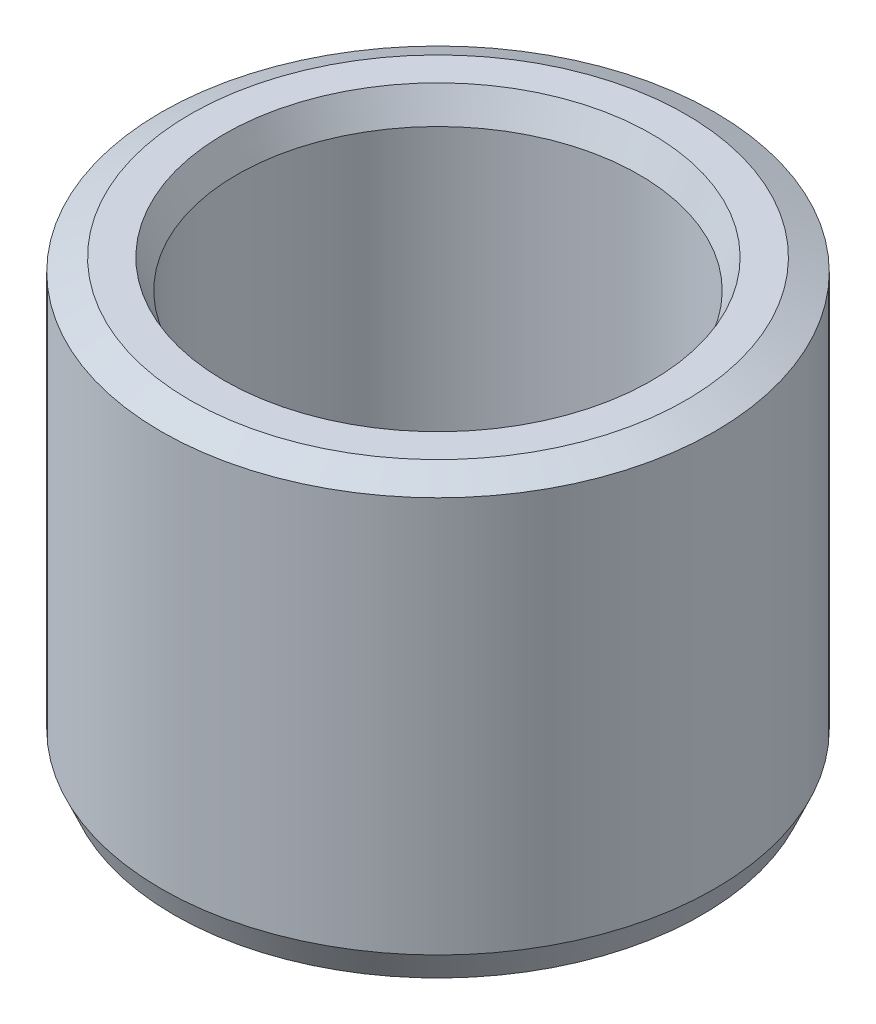
from build123d import *
from OCP.BRepFilletAPI import BRepFilletAPI_MakeChamfer

# Parameters (mm, degrees)
SKETCH1_R           = 57.5
BOSS_EXTRUDE1_DEPTH = 90.925690397
SKETCH2_R           = 41.771925017
CUT_EXTRUDE1_DEPTH  = 122.98352829
CHAMFER1_SIZE       = 2.631994766
CHAMFER1_SIZE2      = 5.999081404


with BuildPart() as part:
    # Sketch1 → Boss-Extrude1 (new body)
    with BuildSketch(Plane(origin=(0, 0, 0), x_dir=(1, 0, 0), z_dir=(0, 1, 0))):
        Circle(SKETCH1_R)
    extrude(amount=BOSS_EXTRUDE1_DEPTH)

    # Sketch2 → Cut-Extrude1 (cut, through all)
    with BuildSketch(Plane(origin=(0, 0, 0), x_dir=(1, 0, 0), z_dir=(0, 1, 0))):
        Circle(SKETCH2_R)
    extrude(amount=CUT_EXTRUDE1_DEPTH, mode=Mode.SUBTRACT)

    # Chamfer1: one chamfer whose edges measure the first distance from different faces: ONE call of the kernel's chamfer builder (chamfer() names one face for all edges)
    chamfer1_edges_1 = [part.edges().sort_by_distance(p)[0] for p in [
        (-41.771925017, 90.925690397, 0),
    ]]
    chamfer1_side_1 = [part.faces().sort_by_distance(p)[0] for p in [
        (-55.873654403, 90.925690397, 0),
    ]]
    chamfer1_edges_2 = [part.edges().sort_by_distance(p)[0] for p in [
        (-41.771925017, 0, 0),
    ]]
    chamfer1_side_2 = [part.faces().sort_by_distance(p)[0] for p in [
        (-41.771925017, 45.462845199, 0),
    ]]
    chamfer1_edges_3 = [part.edges().sort_by_distance(p)[0] for p in [
        (-57.5, 0, 0),
    ]]
    chamfer1_side_3 = [part.faces().sort_by_distance(p)[0] for p in [
        (-55.873654403, 0, 0),
    ]]
    chamfer1_edges_4 = [part.edges().sort_by_distance(p)[0] for p in [
        (-57.5, 90.925690397, 0),
    ]]
    chamfer1_side_4 = [part.faces().sort_by_distance(p)[0] for p in [
        (-57.5, 45.462845199, 0),
    ]]
    chamfer1 = BRepFilletAPI_MakeChamfer(part.part.solid().wrapped)
    for e in chamfer1_edges_1:
        chamfer1.Add(CHAMFER1_SIZE, CHAMFER1_SIZE2, e.wrapped, chamfer1_side_1[0].wrapped)  # the first distance lies on this face
    for e in chamfer1_edges_2:
        chamfer1.Add(CHAMFER1_SIZE, CHAMFER1_SIZE2, e.wrapped, chamfer1_side_2[0].wrapped)  # the first distance lies on this face
    for e in chamfer1_edges_3:
        chamfer1.Add(CHAMFER1_SIZE, CHAMFER1_SIZE2, e.wrapped, chamfer1_side_3[0].wrapped)  # the first distance lies on this face
    for e in chamfer1_edges_4:
        chamfer1.Add(CHAMFER1_SIZE, CHAMFER1_SIZE2, e.wrapped, chamfer1_side_4[0].wrapped)  # the first distance lies on this face
    add(Compound.cast(chamfer1.Shape()), mode=Mode.REPLACE)


solid = part.part
